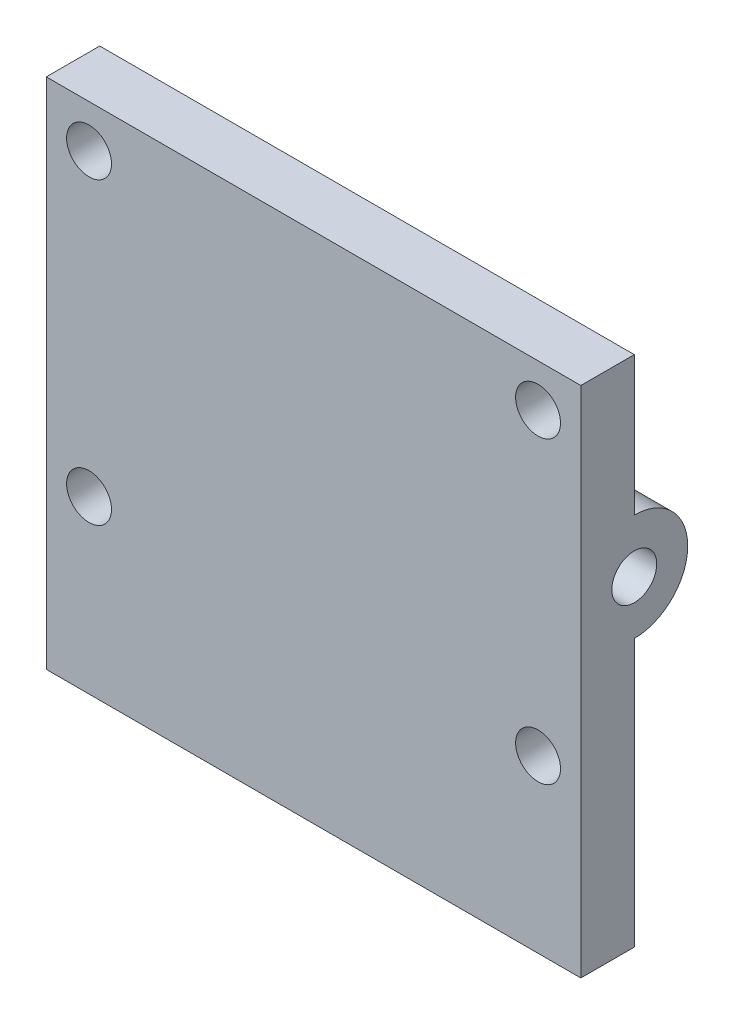
from build123d import *

# Parameters (mm, degrees)
SZKIC2_W                    = 25.000000373
SZKIC2_H                    = 24
SZKIC2_R                    = 1.05
DODANIE_WYCI_GNI_CIE1_DEPTH = 5
SZKIC3_R                    = 1.05
WYTNIJ_WYCI_GNI_CIE1_DEPTH  = 36.134524248
SZKIC4_W                    = 2.5
SZKIC4_H                    = 6.5
SZKIC4_H_2                  = 12.5
WYTNIJ_WYCI_GNI_CIE2_DEPTH  = 36.134524248
ZAOKR_GLENIE5_R             = 2.5


with BuildPart() as part:
    # Szkic2 → Dodanie-wyciągnięcie1 (new body)
    with BuildSketch(Plane.XY):
        with Locations((12.381142653, 12.175085843)):
            Rectangle(SZKIC2_W, SZKIC2_H)
        with Locations((22.881142652, 22.175085947)):
            Circle(SZKIC2_R, mode=Mode.SUBTRACT)
        with Locations((22.881142652, 8.175085947)):
            Circle(SZKIC2_R, mode=Mode.SUBTRACT)
        with Locations((1.881142652, 22.175085947)):
            Circle(SZKIC2_R, mode=Mode.SUBTRACT)
        with Locations((1.881142652, 8.175085947)):
            Circle(SZKIC2_R, mode=Mode.SUBTRACT)
    extrude(amount=DODANIE_WYCI_GNI_CIE1_DEPTH)

    # Szkic3 → Wytnij-wyciągnięcie1 (cut, through all)
    with BuildSketch(Plane(origin=(24.881142839, 0, 0), x_dir=(0, 0, -1), z_dir=(1, 0, 0))):
        with Locations((-2.5, 15.175085843)):
            Circle(SZKIC3_R)
    extrude(amount=-WYTNIJ_WYCI_GNI_CIE1_DEPTH, mode=Mode.SUBTRACT)

    # Szkic4 → Wytnij-wyciągnięcie2 (cut, through all)
    with BuildSketch(Plane.ZY.offset(0.118857534)):
        with Locations((1.25, 20.925085843)):
            Rectangle(SZKIC4_W, SZKIC4_H)
        with Locations((1.25, 6.425085843)):
            Rectangle(SZKIC4_W, SZKIC4_H_2)
    extrude(amount=-WYTNIJ_WYCI_GNI_CIE2_DEPTH, mode=Mode.SUBTRACT)

    # Zaokrąglenie5
    zaokr_glenie5_edges = [part.edges().sort_by_distance(p)[0] for p in [
        (12.381142652, 12.675085843, 0),
        (12.381142652, 17.675085843, 0),
    ]]
    fillet(zaokr_glenie5_edges, radius=ZAOKR_GLENIE5_R - 0.0001)  # a hair under: the kernel refuses the full size


solid = part.part
